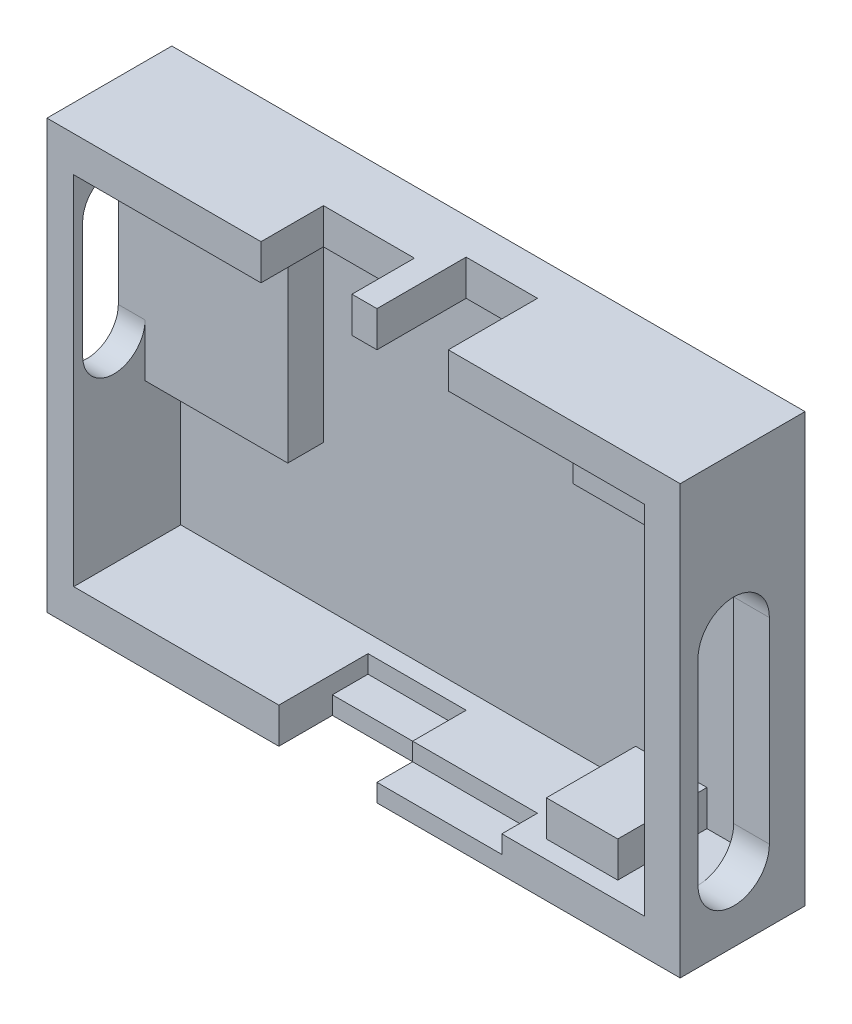
from build123d import *

# Parameters (mm, degrees)
SKETCH_1_W           = 35.5
SKETCH_1_H           = 24
EXTRUDE_1_DEPTH      = 7
SKETCH_2_W           = 33
SKETCH_2_H           = 22
CUT_EXTRUDE_1_DEPTH  = 6
CUT_EXTRUDE_2_DEPTH  = 2
EXTRUDE_2_DEPTH      = 6
SKETCH_7_W           = 4
SKETCH_7_H           = 2
SKETCH_7_W_2         = 5
EXTRUDE_3_DEPTH      = 5
CUT_EXTRUDE_4_DEPTH  = 2
SKETCH_12_W          = 5.5
SKETCH_12_H          = 1
CUT_EXTRUDE_6_DEPTH  = 5
SKETCH_16_W          = 5.1
SKETCH_16_H          = 3.5
CUT_EXTRUDE_8_DEPTH  = 5
SKETCH_18_W          = 7
SKETCH_18_H          = 1
FPC_DEPTH            = 2
SKETCH_19_W          = 8
SKETCH_19_H          = 12
USB_DEPTH            = 2
SKETCH_20_W          = 4
SKETCH_20_H          = 5
CUT_EXTRUDE_10_DEPTH = 2
SKETCH_22_W          = 5.5
SKETCH_22_H          = 3
CUT_EXTRUDE_11_DEPTH = 2


with BuildPart() as part:
    # 草图1 → 凸台-拉伸1 (new body)
    with BuildSketch(Plane.XY):
        Rectangle(SKETCH_1_W, SKETCH_1_H)
    extrude(amount=EXTRUDE_1_DEPTH)

    # 草图2 → 切除-拉伸1 (cut)
    with BuildSketch(Plane.XY.offset(7)):
        with Locations((0.25, 0)):
            Rectangle(SKETCH_2_W, SKETCH_2_H)
    extrude(amount=-CUT_EXTRUDE_1_DEPTH, mode=Mode.SUBTRACT)

    # 草图3 → 切除-拉伸2 (cut)
    with BuildSketch(Plane.ZY.offset(17.75)):
        with BuildLine():
            Line((6.5, 7.45), (6.5, 0.95))
            ThreePointArc((6.5, 0.95), (4.75, -0.8), (3, 0.95))
            Line((3, 0.95), (3, 7.45))
            ThreePointArc((3, 7.45), (4.75, 9.2), (6.5, 7.45))
        make_face()
    extrude(amount=-CUT_EXTRUDE_2_DEPTH, mode=Mode.SUBTRACT)

    # 草图6 → 凸台-拉伸2 (add)
    with BuildSketch(Plane.XY.offset(1)):
        Polygon((-16.25, 10), (15.75, 10), (15.75, -10), (-16.25, -10), (-16.25, -11), (16.75, -11), (16.75, 11), (-16.25, 11), align=None)
    extrude(amount=EXTRUDE_2_DEPTH)

    # 草图7 → 凸台-拉伸3 (add)
    with BuildSketch(Plane.XY.offset(1)):
        with Locations((11.25, -9)):
            Rectangle(SKETCH_7_W, SKETCH_7_H)
        with Locations((13.25, 9)):
            Rectangle(SKETCH_7_W_2, SKETCH_7_H)
    extrude(amount=EXTRUDE_3_DEPTH)

    # 草图10 → 切除-拉伸4 (cut)
    with BuildSketch(Plane.ZY.offset(-15.75)):
        with BuildLine():
            Line((2, -8), (2, 3))
            ThreePointArc((2, 3), (4, 5), (6, 3))
            Line((6, 3), (6, -8))
            ThreePointArc((6, -8), (4, -10), (2, -8))
        make_face()
    extrude(amount=-CUT_EXTRUDE_4_DEPTH, mode=Mode.SUBTRACT)

    # 草图12 → 切除-拉伸6 (cut)
    with BuildSketch(Plane.XY.offset(7)):
        with Locations((-2, -10.5)):
            Rectangle(SKETCH_12_W, SKETCH_12_H)
    extrude(amount=-CUT_EXTRUDE_6_DEPTH, mode=Mode.SUBTRACT)

    # 草图16 → 切除-拉伸8 (cut)
    with BuildSketch(Plane.XZ.offset(-10)):
        with Locations((-3.2, 5.25)):
            Rectangle(SKETCH_16_W, SKETCH_16_H)
    extrude(amount=-CUT_EXTRUDE_8_DEPTH, mode=Mode.SUBTRACT)

    # 草图18 → FPC排线间隙 (cut)
    with BuildSketch(Plane.XY.offset(7)):
        with Locations((4.25, -10.5)):
            Rectangle(SKETCH_18_W, SKETCH_18_H)
    extrude(amount=-FPC_DEPTH, mode=Mode.SUBTRACT)

    # 草图19 → USB支撑 (add)
    with BuildSketch(Plane.XY.offset(1)):
        with Locations((-12.25, 4)):
            Rectangle(SKETCH_19_W, SKETCH_19_H)
    extrude(amount=USB_DEPTH)

    # 草图20 → 切除-拉伸10 (cut)
    with BuildSketch(Plane(origin=(0, 12, 0), x_dir=(1, 0, 0), z_dir=(0, 1, 0))):
        with Locations((2.75, -4.5)):
            Rectangle(SKETCH_20_W, SKETCH_20_H)
    extrude(amount=-CUT_EXTRUDE_10_DEPTH, mode=Mode.SUBTRACT)

    # 草图22 → 切除-拉伸11 (cut)
    with BuildSketch(Plane(origin=(0, -11, 0), x_dir=(1, 0, 0), z_dir=(0, 1, 0))):
        with Locations((-2, -5.5)):
            Rectangle(SKETCH_22_W, SKETCH_22_H)
    extrude(amount=-CUT_EXTRUDE_11_DEPTH, mode=Mode.SUBTRACT)


solid = part.part
